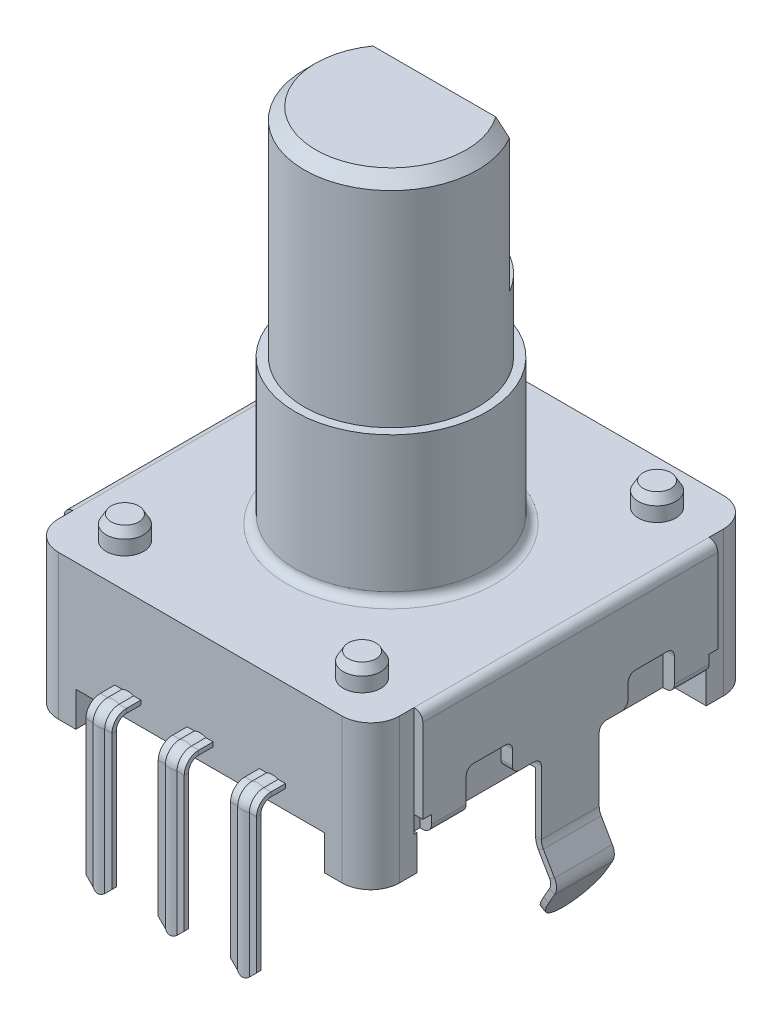
from build123d import *
from OCP.BRepFilletAPI import BRepFilletAPI_MakeChamfer

# Parameters (mm, degrees)
SKETCH1_W            = 11.8
SKETCH1_H            = 13.2
BOSS_EXTRUDE1_DEPTH  = 5
SKETCH2_R            = 3.3
BOSS_EXTRUDE2_DEPTH  = 5
SKETCH3_R            = 3
BOSS_EXTRUDE3_DEPTH  = 7.5
CUT_EXTRUDE1_START   = -5
CUT_EXTRUDE1_DEPTH   = 5
CUT_EXTRUDE2_DEPTH   = 1.2
SKETCH10_W           = 0.3
SKETCH10_H           = 10.2
BOSS_EXTRUDE4_DEPTH  = 3.8
SKETCH12_W           = 0.2
SKETCH12_H           = 2
CUT_EXTRUDE3_REACH   = 27.116
SKETCH14_W           = 0.3
SKETCH14_H           = 0.6
CUT_EXTRUDE4_DEPTH   = 0.4
FILLET4_R            = 0.25
FILLET4_OF_MIRROR3_R = 0.25
MIRROR6_START        = -6.2
MIRROR6_OUTLINE_W    = 0.6
MIRROR6_OUTLINE_H    = 0.3
MIRROR6_DEPTH        = 0.4
MIRROR6_START_2      = 5.8
MIRROR6_2_OUTLINE_W  = 0.6
MIRROR6_2_OUTLINE_H  = 0.3
MIRROR6_2_DEPTH      = 0.4
FILLET1_R            = 0.3
CUT_EXTRUDE5_REACH   = 25.427
LPATTERN1_COUNT      = 2
LPATTERN1_PITCH      = 2.5
LPATTERN1_COL_COUNT  = 2
LPATTERN1_COL_PITCH  = 2.5
FILLET3_R            = 1
SKETCH19_R           = 0.65
BOSS_EXTRUDE5_DEPTH  = 0.8
CHAMFER1_SIZE        = 0.3
CHAMFER1_SIZE2       = 0.173205081
FILLET6_R            = 0.3
CHAMFER2_SIZE        = 0.4


# Read off the part's stored shape, not the designer's step: Mirror6
with BuildPart() as part:
    # Sketch1 → Boss-Extrude1 (new body)
    with BuildSketch(Plane(origin=(0, 0, 0), x_dir=(1, 0, 0), z_dir=(0, 1, 0))):
        Rectangle(SKETCH1_W, SKETCH1_H)
    extrude(amount=BOSS_EXTRUDE1_DEPTH)

    # Sketch2 → Boss-Extrude2 (add)
    with BuildSketch(Plane(origin=(0, 5, 0), x_dir=(1, 0, 0), z_dir=(0, 1, 0))):
        with Locations(Location((0, 0, 0), (0, 0, 270))):
            Circle(SKETCH2_R)
    extrude(amount=BOSS_EXTRUDE2_DEPTH)

    # Sketch3 → Boss-Extrude3 (add)
    with BuildSketch(Plane(origin=(0, 10, 0), x_dir=(1, 0, 0), z_dir=(0, 1, 0))):
        with Locations(Location((0, 0, 0), (0, 0, 270))):
            Circle(SKETCH3_R)
    extrude(amount=BOSS_EXTRUDE3_DEPTH)

    # Sketch4 → Cut-Extrude1 (cut)
    with BuildSketch(Plane(origin=(0, 17.5, 0), x_dir=(1, 0, 0), z_dir=(0, 1, 0)).offset(CUT_EXTRUDE1_START)):
        with BuildLine():
            Line((-2.598076211, 1.5), (2.598076211, 1.5))
            ThreePointArc((2.598076211, 1.5), (0, 3), (-2.598076211, 1.5))
        make_face()
    extrude(amount=CUT_EXTRUDE1_DEPTH, mode=Mode.SUBTRACT)

    # Sketch5 → Cut-Extrude2 (cut)
    with BuildSketch(Plane.XZ):
        Polygon((-5.9, 5), (-4.3, 5), (-4.3, 6.6), (4.3, 6.6), (4.3, 5), (5.9, 5), (5.9, -5), (4.3, -5), (4.3, -6.6), (-4.3, -6.6), (-4.3, -5), (-5.9, -5), align=None)
    extrude(amount=-CUT_EXTRUDE2_DEPTH, mode=Mode.SUBTRACT)

    # Sketch10 → Boss-Extrude4 (add)
    with BuildSketch(Plane(origin=(0, 5, 0), x_dir=(1, 0, 0), z_dir=(0, 1, 0))):
        with Locations((-6.05, 0)):
            Rectangle(SKETCH10_W, SKETCH10_H)
    boss_extrude4 = extrude(amount=-BOSS_EXTRUDE4_DEPTH)

    # Mirror1: Boss-Extrude4 across plane
    add(boss_extrude4.mirror(Plane(origin=(0, 0, 0), x_dir=(0, 0, 1), z_dir=(1, 0, 0))))

    # Sweep1: sweep along a path in Sketch11
    with BuildLine(Plane.XY) as sweep1_path:
        Line((-6.2, 1.2), (-6.2, -0.854551733))
        ThreePointArc((-6.2, -0.854551733), (-6.217037087, -0.983961255), (-6.266987298, -1.104551733))
        Line((-6.266987298, -1.104551733), (-6.655662433, -1.777756814))
        ThreePointArc((-6.655662433, -1.777756814), (-6.722649731, -2.027756814), (-6.655662433, -2.277756814))
        Line((-6.655662433, -2.277756814), (-5.95, -3.5))
    # Sketch12 → Sweep1 (sweep)
    with BuildSketch(Plane.XZ.offset(-1.2)):
        with Locations((-6.1, 0)):
            Rectangle(SKETCH12_W, SKETCH12_H)
    sweep1 = sweep(path=sweep1_path.line)

    # Sketch13 → Cut-Extrude3 (cut, up to next)
    with BuildSketch(Plane(origin=(-5.978044457, -3.451425576, 0), x_dir=(0, 0, 1), z_dir=(-0.866025403784438, -0.500000000000001, 0)), mode=Mode.PRIVATE) as cut_extrude3_sk1:
        with BuildLine():
            ThreePointArc((0, -0.056088913), (-0.707106781, 0.236804306), (-1, 0.943911087))
            Line((-1, 0.943911087), (-1, -0.056088913))
            Line((-1, -0.056088913), (0, -0.056088913))
        make_face()
    cut_extrude3_tool1 = extrude(cut_extrude3_sk1.sketch, amount=-CUT_EXTRUDE3_REACH, mode=Mode.PRIVATE) & part.part
    # Sketch13 → Cut-Extrude3 (cut, up to next)
    with BuildSketch(Plane(origin=(-5.978044457, -3.451425576, 0), x_dir=(0, 0, 1), z_dir=(-0.866025403784438, -0.500000000000001, 0)), mode=Mode.PRIVATE) as cut_extrude3_sk2:
        with BuildLine():
            ThreePointArc((1, 0.943911087), (0.707106781, 0.236804306), (0, -0.056088913))
            Line((0, -0.056088913), (1, -0.056088913))
            Line((1, -0.056088913), (1, 0.943911087))
        make_face()
    cut_extrude3_tool2 = extrude(cut_extrude3_sk2.sketch, amount=-CUT_EXTRUDE3_REACH, mode=Mode.PRIVATE) & part.part
    cut_extrude3_1 = cut_extrude3_tool1.solids().sort_by_distance((-6.061684, -3.306558, -0.776632))[0]
    add(cut_extrude3_1, mode=Mode.SUBTRACT)
    cut_extrude3_2 = cut_extrude3_tool2.solids().sort_by_distance((-6.061684, -3.306558, 0.776632))[0]
    add(cut_extrude3_2, mode=Mode.SUBTRACT)
    cut_extrude3 = cut_extrude3_1 + cut_extrude3_2  # Cut-Extrude3 as one shape, for the pattern or mirror that repeats it

    # Mirror2: Sweep1, Cut-Extrude3 across plane
    add(sweep1.mirror(Plane(origin=(0, 0, 0), x_dir=(0, 0, 1), z_dir=(1, 0, 0))))
    add(cut_extrude3.mirror(Plane(origin=(0, 0, 0), x_dir=(0, 0, 1), z_dir=(1, 0, 0))), mode=Mode.SUBTRACT)

    # Sketch14 → Cut-Extrude4 (cut)
    with BuildSketch(Plane.ZY.offset(6.2)):
        with Locations((-4.95, 1.5)):
            Rectangle(SKETCH14_W, SKETCH14_H)
        Polygon((-3.6, 1.2), (-3.6, 2.6), (-2, 2.6), (-2, 1.6), (-1, 1.6), (-1, 1.2), align=None)
    cut_extrude4 = extrude(amount=-CUT_EXTRUDE4_DEPTH, mode=Mode.SUBTRACT)

    # Fillet4
    fillet4_edges = [part.edges().sort_by_distance(p)[0] for p in [
        (-6, 2.6, -3.6),
        (-6, 2.6, -2),
        (-6, 1.6, -2),
        (-6, 1.6, -1),
    ]]
    fillet(fillet4_edges, radius=FILLET4_R)

    # Mirror3: Cut-Extrude4 across plane
    add(cut_extrude4.mirror(Plane(origin=(0, 0, 0), x_dir=(0, 0, 1), z_dir=(1, 0, 0))), mode=Mode.SUBTRACT)

    # Fillet4 of Mirror3
    fillet4_of_mirror3_edges = [part.edges().sort_by_distance(p)[0] for p in [
        (6, 2.6, -3.6),
        (6, 2.6, -2),
        (6, 1.6, -2),
        (6, 1.6, -1),
    ]]
    fillet(fillet4_of_mirror3_edges, radius=FILLET4_OF_MIRROR3_R)

    # Mirror6 outline → Mirror6 (cut)
    with BuildSketch(Plane.YZ.offset(MIRROR6_START)):
        with Locations((1.5, 4.95)):
            Rectangle(MIRROR6_OUTLINE_W, MIRROR6_OUTLINE_H)
        with BuildLine():
            Line((1.2, 1), (1.35, 1))
            ThreePointArc((1.35, 1), (1.526776695, 1.073223305), (1.6, 1.25))
            Line((1.6, 1.25), (1.6, 1.75))
            ThreePointArc((1.6, 1.75), (1.673223305, 1.926776695), (1.85, 2))
            Line((1.85, 2), (2.35, 2))
            ThreePointArc((2.35, 2), (2.526776695, 2.073223305), (2.6, 2.25))
            Line((2.6, 2.25), (2.6, 3.35))
            ThreePointArc((2.6, 3.35), (2.526776695, 3.526776695), (2.35, 3.6))
            Line((2.35, 3.6), (1.2, 3.6))
            Line((1.2, 3.6), (1.2, 1))
        make_face()
    extrude(amount=MIRROR6_DEPTH, mode=Mode.SUBTRACT)

    # Mirror6 2 outline → Mirror6 2 (cut)
    with BuildSketch(Plane.YZ.offset(MIRROR6_START_2)):
        with Locations((1.5, 4.95)):
            Rectangle(MIRROR6_2_OUTLINE_W, MIRROR6_2_OUTLINE_H)
        with BuildLine():
            Line((1.2, 1), (1.35, 1))
            ThreePointArc((1.35, 1), (1.526776695, 1.073223305), (1.6, 1.25))
            Line((1.6, 1.25), (1.6, 1.75))
            ThreePointArc((1.6, 1.75), (1.673223305, 1.926776695), (1.85, 2))
            Line((1.85, 2), (2.35, 2))
            ThreePointArc((2.35, 2), (2.526776695, 2.073223305), (2.6, 2.25))
            Line((2.6, 2.25), (2.6, 3.35))
            ThreePointArc((2.6, 3.35), (2.526776695, 3.526776695), (2.35, 3.6))
            Line((2.35, 3.6), (1.2, 3.6))
            Line((1.2, 3.6), (1.2, 1))
        make_face()
    extrude(amount=MIRROR6_2_DEPTH, mode=Mode.SUBTRACT)

    # Fillet1
    fillet1_edges = [part.edges().sort_by_distance(p)[0] for p in [
        (6.2, 5, 0),
        (-6.2, 5, 0),
        (6.2, 1.2, -4.2),
        (6.2, 1.2, 4.2),
        (-6.2, 1.2, 4.2),
        (-6.2, 1.2, -4.2),
    ]]
    fillet(fillet1_edges, radius=FILLET1_R)

    # Sweep2: sweep along a path in Sketch15
    with BuildLine(Plane(origin=(0, 0, 0), x_dir=(0, 0, -1), z_dir=(1, 0, 0))) as sweep2_path:
        Line((-6.6, 2), (-7.1, 2))
        ThreePointArc((-7.1, 2), (-7.453553391, 1.853553391), (-7.6, 1.5))
        Line((-7.6, 1.5), (-7.6, -3.5))
    # Sketch16 → Sweep2 (sweep)
    with BuildSketch(Plane.XY.offset(6.6)):
        with BuildLine():
            Line((-0.45, 2), (-0.2, 2))
            ThreePointArc((-0.2, 2), (0, 2.041742431), (0.2, 2))
            Line((0.2, 2), (0.45, 2))
            Line((0.45, 2), (0.45, 1.85))
            Line((0.45, 1.85), (-0.45, 1.85))
            Line((-0.45, 1.85), (-0.45, 2))
        make_face()
    sweep2 = sweep(path=sweep2_path.line)

    # Sketch17 → Cut-Extrude5 (cut, up to next)
    with BuildSketch(Plane(origin=(0, 0, 7.45), x_dir=(-1, 0, 0), z_dir=(0, 0, -1)), mode=Mode.PRIVATE) as cut_extrude5_sk1:
        with BuildLine():
            ThreePointArc((0.212132034, -3.412132034), (0.11480503, -3.47716386), (0, -3.5))
            Line((0, -3.5), (0.45, -3.5))
            Line((0.45, -3.5), (0.45, -3.174264069))
            Line((0.45, -3.174264069), (0.212132034, -3.412132034))
        make_face()
    cut_extrude5_tool1 = extrude(cut_extrude5_sk1.sketch, amount=-CUT_EXTRUDE5_REACH, mode=Mode.PRIVATE) & part.part
    # Sketch17 → Cut-Extrude5 (cut, up to next)
    with BuildSketch(Plane(origin=(0, 0, 7.45), x_dir=(-1, 0, 0), z_dir=(0, 0, -1)), mode=Mode.PRIVATE) as cut_extrude5_sk2:
        with BuildLine():
            Line((-0.212132034, -3.412132034), (-0.45, -3.174264069))
            Line((-0.45, -3.174264069), (-0.45, -3.5))
            Line((-0.45, -3.5), (0, -3.5))
            ThreePointArc((0, -3.5), (-0.11480503, -3.47716386), (-0.212132034, -3.412132034))
        make_face()
    cut_extrude5_tool2 = extrude(cut_extrude5_sk2.sketch, amount=-CUT_EXTRUDE5_REACH, mode=Mode.PRIVATE) & part.part
    cut_extrude5_1 = cut_extrude5_tool1.solids().sort_by_distance((-0.333511, -3.394609, 7.45))[0]
    add(cut_extrude5_1, mode=Mode.SUBTRACT)
    cut_extrude5_2 = cut_extrude5_tool2.solids().sort_by_distance((0.333511, -3.394609, 7.45))[0]
    add(cut_extrude5_2, mode=Mode.SUBTRACT)
    cut_extrude5 = cut_extrude5_1 + cut_extrude5_2  # Cut-Extrude5 as one shape, for the pattern or mirror that repeats it

    # LPattern1: Sweep2, Cut-Extrude5 ×2
    with Locations(*[(i * LPATTERN1_PITCH, 0, 0) for i in range(1, LPATTERN1_COUNT)]):
        add(sweep2)
        add(cut_extrude5, mode=Mode.SUBTRACT)

    # LPattern1 col: Sweep2, Cut-Extrude5 ×2
    with Locations(*[(-i * LPATTERN1_COL_PITCH, 0, 0) for i in range(1, LPATTERN1_COL_COUNT)]):
        add(sweep2)
        add(cut_extrude5, mode=Mode.SUBTRACT)

    # Fillet3
    fillet3_edges = [part.edges().sort_by_distance(p)[0] for p in [
        (-5.9, 2.5, -6.6),
        (5.9, 2.5, -6.6),
        (5.9, 2.5, 6.6),
        (-5.9, 2.5, 6.6),
    ]]
    fillet(fillet3_edges, radius=FILLET3_R)

    # Sketch19 → Boss-Extrude5 (add)
    with BuildSketch(Plane(origin=(0, 5, 0), x_dir=(1, 0, 0), z_dir=(0, 1, 0))):
        with Locations(Location((-4.1, 5.1, 0), (0, 0, 270))):
            Circle(SKETCH19_R)
        with Locations(Location((4.1, 5.1, 0), (0, 0, 270))):
            Circle(SKETCH19_R)
        with Locations(Location((4.1, -5.1, 0), (0, 0, 270))):
            Circle(SKETCH19_R)
        with Locations(Location((-4.1, -5.1, 0), (0, 0, 270))):
            Circle(SKETCH19_R)
    extrude(amount=BOSS_EXTRUDE5_DEPTH)

    # Chamfer1: one chamfer whose edges measure the first distance from different faces: ONE call of the kernel's chamfer builder (chamfer() names one face for all edges)
    chamfer1_edges_1 = [part.edges().sort_by_distance(p)[0] for p in [
        (-4.1, 5.8, -5.75),
    ]]
    chamfer1_side_1 = [part.faces().sort_by_distance(p)[0] for p in [
        (-4.1, 5.4, -5.75),
    ]]
    chamfer1_edges_2 = [part.edges().sort_by_distance(p)[0] for p in [
        (4.1, 5.8, -5.75),
    ]]
    chamfer1_side_2 = [part.faces().sort_by_distance(p)[0] for p in [
        (4.1, 5.4, -5.75),
    ]]
    chamfer1_edges_3 = [part.edges().sort_by_distance(p)[0] for p in [
        (4.1, 5.8, 4.45),
    ]]
    chamfer1_side_3 = [part.faces().sort_by_distance(p)[0] for p in [
        (4.1, 5.4, 4.45),
    ]]
    chamfer1_edges_4 = [part.edges().sort_by_distance(p)[0] for p in [
        (-4.1, 5.8, 4.45),
    ]]
    chamfer1_side_4 = [part.faces().sort_by_distance(p)[0] for p in [
        (-4.1, 5.4, 4.45),
    ]]
    chamfer1 = BRepFilletAPI_MakeChamfer(part.part.solid().wrapped)
    for e in chamfer1_edges_1:
        chamfer1.Add(CHAMFER1_SIZE, CHAMFER1_SIZE2, e.wrapped, chamfer1_side_1[0].wrapped)  # the first distance lies on this face
    for e in chamfer1_edges_2:
        chamfer1.Add(CHAMFER1_SIZE, CHAMFER1_SIZE2, e.wrapped, chamfer1_side_2[0].wrapped)  # the first distance lies on this face
    for e in chamfer1_edges_3:
        chamfer1.Add(CHAMFER1_SIZE, CHAMFER1_SIZE2, e.wrapped, chamfer1_side_3[0].wrapped)  # the first distance lies on this face
    for e in chamfer1_edges_4:
        chamfer1.Add(CHAMFER1_SIZE, CHAMFER1_SIZE2, e.wrapped, chamfer1_side_4[0].wrapped)  # the first distance lies on this face
    add(Compound.cast(chamfer1.Shape()), mode=Mode.REPLACE)

    # Fillet6
    fillet6_edges = [part.edges().sort_by_distance(p)[0] for p in [
        (0, 5, -3.3),
    ]]
    fillet(fillet6_edges, radius=FILLET6_R)

    # Chamfer2
    chamfer2_edges = [part.edges().sort_by_distance(p)[0] for p in [
        (-2.598076211, 17.5, 1.5),
    ]]
    chamfer(chamfer2_edges, length=CHAMFER2_SIZE)


solid = part.part
